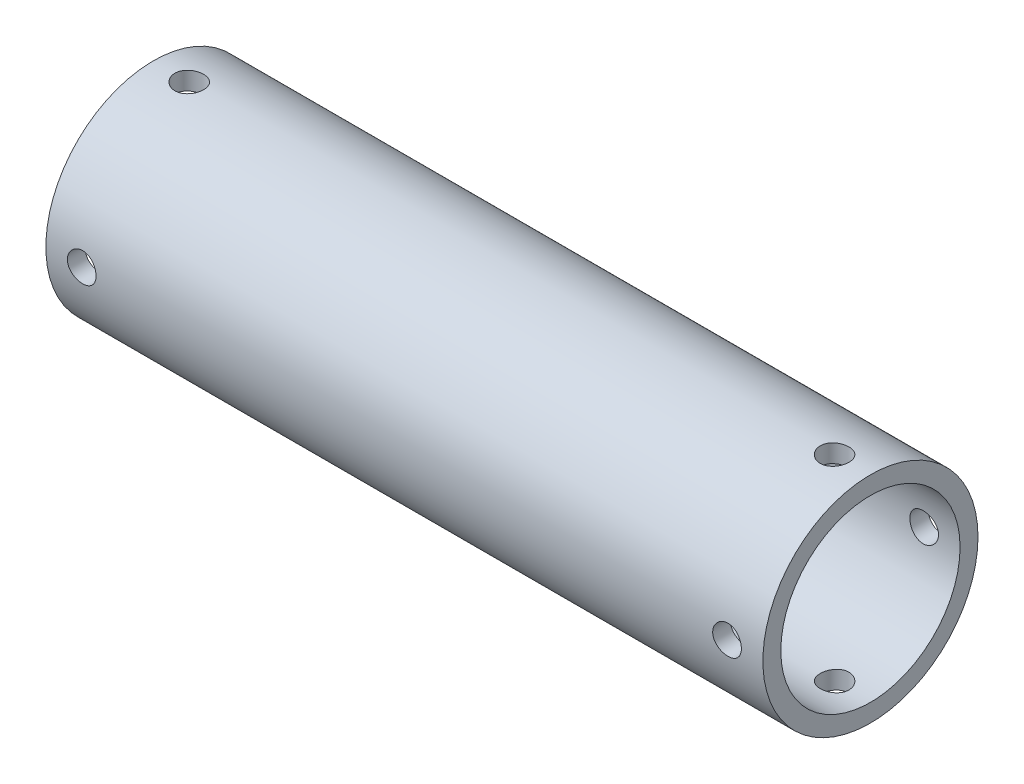
from build123d import *

# Parameters (mm, degrees)
SKETCH_2_R               = 30
SKETCH_2_R_2             = 25
EXTRUDE_2_DEPTH          = 200
SKETCH_4_R               = 4
CUT_EXTRUDE_2_DEPTH      = 10
PATTERN_CIRCULAR_1_COUNT = 4


with BuildPart() as part:
    # Эскиз2 → Бобышка-Вытянуть2 (new body)
    with BuildSketch(Plane(origin=(0, 0, 0), x_dir=(0, 0, -1), z_dir=(1, 0, 0))):
        Circle(SKETCH_2_R)
        Circle(SKETCH_2_R_2, mode=Mode.SUBTRACT)
    extrude(amount=EXTRUDE_2_DEPTH)

    # Эскиз4 → Вырез-Вытянуть2 (cut, symmetric)
    with BuildSketch(Plane.XY.offset(25)):
        with Locations((10, 0)):
            Circle(SKETCH_4_R)
        with Locations((190, 0)):
            Circle(SKETCH_4_R)
    cut_extrude_2 = extrude(amount=CUT_EXTRUDE_2_DEPTH, both=True, mode=Mode.SUBTRACT)

    # Круговой массив1: Вырез-Вытянуть2 ×4 about axis
    pattern_circular_1_axis = Axis((200, 0, 0), (-1, 0, 0))
    for i in range(1, PATTERN_CIRCULAR_1_COUNT):
        add(cut_extrude_2.rotate(pattern_circular_1_axis, i * 360 / PATTERN_CIRCULAR_1_COUNT), mode=Mode.SUBTRACT)


solid = part.part
